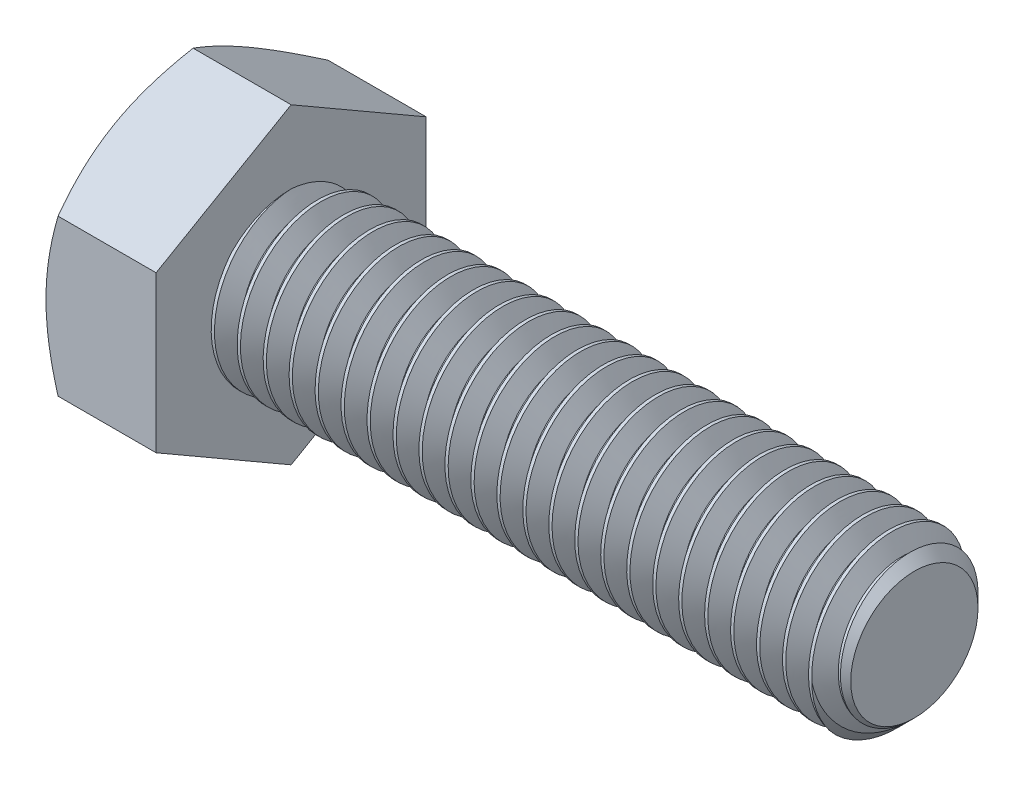
from build123d import *

# Parameters (mm, degrees)
SKETCH2_R           = 4
BOSS_EXTRUDE1_DEPTH = 30
CHAMFER1_SIZE       = 0.9375
CUT_SWEEP1_PITCH    = 1.25
BOSS_EXTRUDE2_DEPTH = 5.3
SKETCH6_OUTSIDE_W   = 153.592
SKETCH6_OUTSIDE_H   = 155.604
SKETCH6_OUTSIDE_R   = 6.5
CUT_EXTRUDE1_DEPTH  = 37.66978788
CUT_EXTRUDE1_DRAFT  = -60
SKETCH7_W           = 0.263417301
SKETCH7_H           = 0.263417301
CUT_EXTRUDE2_DEPTH  = 0.25


with BuildPart() as part:
    # Sketch2 → Boss-Extrude1 (new body)
    with BuildSketch(Plane(origin=(17.65, 0, 0), x_dir=(0, 0, -1), z_dir=(1, 0, 0))):
        Circle(SKETCH2_R)
    extrude(amount=-BOSS_EXTRUDE1_DEPTH)

    # Chamfer1
    chamfer1_edges = [part.edges().sort_by_distance(p)[0] for p in [
        (17.65, 0, 4),
    ]]
    chamfer(chamfer1_edges, length=CHAMFER1_SIZE)

    # Cut-Sweep1: arcs per turn and ends read off the stored shape
    # Cut-Sweep1: the profile of Sketch5 profile screwed along a right-hand helix through 25 turns, 8 arcs to a turn; built about Z, then put on its axis
    cut_sweep1_z = Axis((0, 0, 0), (0, 0, 1))
    cut_sweep1_corners = [(4.0003, 0, 0.000173205), (3.188101184, 0, -0.46875), (3.188101184, 0, -0.625), (4.0003, 0, -1.093923205)]
    with BuildLine(mode=Mode.PRIVATE) as cut_sweep1_profile:
        Line(cut_sweep1_corners[0], cut_sweep1_corners[1])
        Line(cut_sweep1_corners[1], cut_sweep1_corners[2])
        Line(cut_sweep1_corners[2], cut_sweep1_corners[3])
        Line(cut_sweep1_corners[3], cut_sweep1_corners[0])
    cut_sweep1_cap = Face(cut_sweep1_profile.wire())
    cut_sweep1_turn_angles = [0, 22.5, 45, 67.5, 90, 112.5, 135, 157.5, 180, 202.5, 225, 247.5, 270, 292.5, 315, 337.5, 360]
    cut_sweep1_turn_weights = [1, 0.9238795325112867, 1, 0.9238795325112867, 1, 0.9238795325112867, 1, 0.9238795325112867, 1, 0.9238795325112867, 1, 0.9238795325112867, 1, 0.9238795325112867, 1, 0.9238795325112867, 1]
    cut_sweep1_turn_rails = [Edge.make_bspline([Vector(p[0], p[1], 0).rotate(cut_sweep1_z, cut_sweep1_turn_angles[k]) / cut_sweep1_turn_weights[k] + Vector(0, 0, p[2] + CUT_SWEEP1_PITCH * cut_sweep1_turn_angles[k] / 360) for k in range(17)], [0, 0, 0, 1, 1, 2, 2, 3, 3, 4, 4, 5, 5, 6, 6, 7, 7, 8, 8, 8], 2, cut_sweep1_turn_weights) for p in cut_sweep1_corners]
    cut_sweep1_turn_sides = [Face.make_surface_from_curves(cut_sweep1_turn_rails[p[0]], cut_sweep1_turn_rails[p[1]]) for p in [(0, 1), (1, 2), (2, 3), (3, 0)]]
    cut_sweep1 = Plane(origin=(17.65, 0, 0), x_dir=(0, 1, 0), z_dir=(-1, 0, 0)) * Solid(Shell([*[p.moved(Location((0, 0, CUT_SWEEP1_PITCH * i))) for i in range(25) for p in cut_sweep1_turn_sides], cut_sweep1_cap, cut_sweep1_cap.rotate(cut_sweep1_z, 9000).moved(Location((0, 0, CUT_SWEEP1_PITCH * 9000 / 360)))]))
    add(cut_sweep1, mode=Mode.SUBTRACT)

    # Sketch3 → Boss-Extrude2 (add)
    with BuildSketch(Plane.ZY.offset(12.35)):
        Polygon((-6.5, -3.75277675), (0, -7.505553499), (6.5, -3.75277675), (6.5, 3.75277675), (0, 7.505553499), (-6.5, 3.75277675), align=None)
    extrude(amount=BOSS_EXTRUDE2_DEPTH)


with BuildPart() as cut_extrude1_tool:
    # Sketch6 outside → Cut-Extrude1 (with draft: the straight prism first)
    with BuildSketch(Plane.ZY.offset(17.65)):
        Rectangle(SKETCH6_OUTSIDE_W, SKETCH6_OUTSIDE_H)
        Circle(SKETCH6_OUTSIDE_R, mode=Mode.SUBTRACT)
    extrude(amount=-CUT_EXTRUDE1_DEPTH)
    # Cut-Extrude1: the draft: its side faces are tilted about the plane it starts from
    cut_extrude1_sides = [cut_extrude1_tool.faces().sort_by_distance(p)[0] for p in [
        (1.18489394, -77.802, 0),
        (1.18489394, 0, 76.796),
        (1.18489394, 77.802, 0),
        (1.18489394, 0, -76.796),
        (1.18489394, 0, -6.5),
    ]]
    draft(cut_extrude1_sides, Plane.ZY.offset(17.65), CUT_EXTRUDE1_DRAFT)


with BuildPart() as part_1:
    add(part.part)

    # Cut-Extrude1: cut by cut_extrude1_tool
    add(cut_extrude1_tool.part, mode=Mode.SUBTRACT)

    # Sketch7 → Cut-Extrude2 (cut)
    # profile 1 of 4: a face of its own
    with BuildSketch(Plane.ZY.offset(17.65)):
        with BuildLine():
            Line((-1.712212457, 3.25), (-1.975629758, 3.25))
            Line((-1.975629758, 3.25), (-1.975629758, 4.851083283))
            add(Edge.make_bspline(
                [(-1.975629758, 4.851083283), (-1.990797349, 4.836456007), (-2.022321526, 4.806054817), (-2.075609816, 4.763029542), (-2.135086359, 4.719421601), (-2.199978812, 4.677487692), (-2.266125691, 4.638011438), (-2.330048133, 4.602508617), (-2.390678926, 4.572464616), (-2.430616757, 4.556036438), (-2.449780899, 4.548153387)],
                knots=[0, 0, 0, 0, 0.893362401, 1.856755847, 2.901947673, 4.020460078, 5.132200827, 6.168787962, 7.121294059, 8, 8, 8, 8], degree=3))
            Line((-2.449780899, 4.548153387), (-2.449780899, 4.790991211))
            add(Edge.make_bspline(
                [(-2.449780899, 4.790991211), (-2.416864504, 4.807943221), (-2.351988236, 4.841354628), (-2.260332099, 4.899060722), (-2.174761236, 4.961616503), (-2.096692183, 5.029008122), (-2.026708251, 5.097894454), (-1.967731776, 5.167403469), (-1.918384014, 5.234987266), (-1.893625307, 5.28211947), (-1.881787344, 5.304654948)],
                knots=[0, 0, 0, 0, 1.141258006, 2.249351951, 3.335817539, 4.406819942, 5.426913362, 6.360259544, 7.215985427, 8, 8, 8, 8], degree=3))
            Line((-1.881787344, 5.304654948), (-1.712212457, 5.304654948))
            Line((-1.712212457, 5.304654948), (-1.712212457, 3.25))
        make_face()
    # profile 2 of 4: a face of its own
    with BuildSketch(Plane.ZY.offset(17.65)):
        with BuildLine():
            add(Edge.make_bspline(
                [(-1.053669204, 4.26333343), (-1.053403811, 4.292696335), (-1.052884018, 4.350205901), (-1.04965991, 4.434352728), (-1.044030879, 4.514263485), (-1.035628286, 4.589868774), (-1.025678041, 4.66133925), (-1.01274266, 4.728572918), (-0.998188475, 4.791720628), (-0.980726066, 4.850716558), (-0.961540595, 4.906067965), (-0.939774065, 4.957686055), (-0.915283767, 5.005516098), (-0.889273246, 5.05005412), (-0.860373255, 5.090607372), (-0.830328139, 5.128313943), (-0.796954399, 5.161790986), (-0.761639786, 5.191899869), (-0.723864284, 5.218469203), (-0.683827763, 5.241395334), (-0.641684272, 5.261637455), (-0.596630603, 5.276875718), (-0.549602061, 5.289298133), (-0.500236646, 5.298436212), (-0.448479956, 5.303823417), (-0.413111534, 5.30437464), (-0.395125952, 5.304654948)],
                knots=[0, 0, 0, 0, 1.514747001, 2.966751498, 4.343369068, 5.64627492, 6.890416844, 8.064737671, 9.177176366, 10.232018008, 11.237056675, 12.19799043, 13.119080079, 14.007588942, 14.855863561, 15.685992447, 16.491747269, 17.290132607, 18.077525251, 18.870243746, 19.668095604, 20.485086593, 21.319398728, 22.175900658, 23.072407314, 24, 24, 24, 24], degree=3))
            add(Edge.make_bspline(
                [(-0.395125952, 5.304654948), (-0.368738762, 5.303879183), (-0.316900071, 5.302355162), (-0.241215314, 5.289925525), (-0.169887308, 5.268662714), (-0.102962395, 5.239978266), (-0.041584646, 5.203543495), (0.01322827, 5.159251481), (0.060885109, 5.107567279), (0.100865769, 5.04787845), (0.135812857, 4.981831611), (0.166859083, 4.909130317), (0.194923969, 4.82985604), (0.214839423, 4.758894496), (0.2290451, 4.697637972), (0.23844813, 4.647115325), (0.246254529, 4.592601104), (0.252235287, 4.534227193), (0.257142357, 4.472059066), (0.260931862, 4.406058014), (0.262855424, 4.336059078), (0.263226498, 4.28802977), (0.263417301, 4.26333343)],
                knots=[0, 0, 0, 0, 1.134486744, 2.228744715, 3.287356444, 4.328707449, 5.352829806, 6.347195599, 7.349461267, 8.364207941, 9.428085653, 10.559314403, 11.761222316, 13.04268526, 13.726896727, 14.465273606, 15.252205015, 16.094778733, 16.988606776, 17.934225168, 18.937792761, 20, 20, 20, 20], degree=3))
            add(Edge.make_bspline(
                [(0.263417301, 4.26333343), (0.263146937, 4.234108446), (0.262618727, 4.177011689), (0.259481011, 4.093539578), (0.253512791, 4.014231709), (0.246168788, 3.93890641), (0.23505885, 3.867764764), (0.223087289, 3.80050451), (0.208281426, 3.737431068), (0.191006459, 3.678516795), (0.171550924, 3.623450173), (0.15021492, 3.57181504), (0.126583246, 3.523646677), (0.099952535, 3.479414897), (0.071541263, 3.438532594), (0.041141347, 3.400846412), (0.008108274, 3.366898762), (-0.027524579, 3.336880189), (-0.065034849, 3.309839686), (-0.105168706, 3.286687205), (-0.147750491, 3.267505776), (-0.192495698, 3.251106608), (-0.239858332, 3.239090259), (-0.289464895, 3.229891932), (-0.341498164, 3.224475291), (-0.377003388, 3.223934368), (-0.395125952, 3.22365827)],
                knots=[0, 0, 0, 0, 1.508974709, 2.94807912, 4.311757619, 5.615040294, 6.854280449, 8.028314546, 9.141715822, 10.197470207, 11.196696834, 12.155719058, 13.080757287, 13.963948316, 14.818758719, 15.649605906, 16.461113142, 17.260189315, 18.052359509, 18.845763934, 19.647754795, 20.461145776, 21.303032214, 22.167241874, 23.064524267, 24, 24, 24, 24], degree=3))
            add(Edge.make_bspline(
                [(-0.395125952, 3.22365827), (-0.418886733, 3.224336047), (-0.465213718, 3.225657527), (-0.532870864, 3.234636168), (-0.596370704, 3.250438997), (-0.656248823, 3.271632819), (-0.711832175, 3.299980776), (-0.763386148, 3.334471601), (-0.811946681, 3.37430283), (-0.839901077, 3.405728755), (-0.854048281, 3.421632835)],
                knots=[0, 0, 0, 0, 1.10322584, 2.150986741, 3.161425019, 4.136713905, 5.093944212, 6.049774532, 7.013026876, 8, 8, 8, 8], degree=3))
            add(Edge.make_bspline(
                [(-0.854048281, 3.421632835), (-0.870332038, 3.445122393), (-0.903909841, 3.493558868), (-0.943209749, 3.57614755), (-0.978265963, 3.667066094), (-1.005778664, 3.76809831), (-1.027327966, 3.878440095), (-1.042891943, 3.998307965), (-1.051699622, 4.127650132), (-1.052997856, 4.217084674), (-1.053669204, 4.26333343)],
                knots=[0, 0, 0, 0, 0.779365345, 1.607084704, 2.489375761, 3.438383567, 4.461919411, 5.557722155, 6.737039282, 8, 8, 8, 8], degree=3))
        make_face()
        with BuildLine():
            add(Edge.make_bspline(
                [(-0.790251903, 4.264156609), (-0.789990351, 4.224638121), (-0.789489681, 4.148990994), (-0.784258903, 4.040916022), (-0.775254335, 3.943417645), (-0.763349706, 3.856630855), (-0.747630777, 3.780438257), (-0.727893802, 3.715034013), (-0.705645537, 3.659633124), (-0.678113731, 3.61492224), (-0.647969444, 3.578476348), (-0.616847528, 3.547131701), (-0.584015791, 3.52048947), (-0.549688457, 3.498275282), (-0.513332913, 3.481456158), (-0.4753467, 3.46926562), (-0.435721553, 3.462250153), (-0.408735027, 3.461242162), (-0.395125952, 3.460733841)],
                knots=[0, 0, 0, 0, 1.89448813, 3.626469325, 5.185477471, 6.587276848, 7.82441448, 8.910550357, 9.859733512, 10.6775885, 11.416198291, 12.123144072, 12.791880183, 13.439617036, 14.078171869, 14.70637855, 15.347637704, 16, 16, 16, 16], degree=3))
            add(Edge.make_bspline(
                [(-0.395125952, 3.460733841), (-0.381520284, 3.461253269), (-0.354540516, 3.462283284), (-0.314823811, 3.469144054), (-0.276985394, 3.481962153), (-0.240684056, 3.498721871), (-0.206107221, 3.520429731), (-0.17343673, 3.547172596), (-0.14215087, 3.578498631), (-0.11214199, 3.615368141), (-0.084819938, 3.660285738), (-0.062154323, 3.715641498), (-0.042724938, 3.781160284), (-0.026919756, 3.857314062), (-0.014966019, 3.943963635), (-0.006015893, 4.041191596), (-0.000750109, 4.149127511), (-0.000257703, 4.224637943), (0, 4.264156609)],
                knots=[0, 0, 0, 0, 0.652509534, 1.29391342, 1.924290653, 2.562989607, 3.207355802, 3.876242846, 4.583348185, 5.32723334, 6.150888545, 7.094226006, 8.186903555, 9.424320409, 10.81992305, 12.379283064, 14.105084285, 16, 16, 16, 16], degree=3))
            add(Edge.make_bspline(
                [(0, 4.264156609), (-0.000249452, 4.30285302), (-0.000727391, 4.376993878), (-0.006128987, 4.482986783), (-0.014593772, 4.57884869), (-0.026172254, 4.664667974), (-0.041560054, 4.740351467), (-0.060223356, 4.806060288), (-0.082463471, 4.861654304), (-0.108906889, 4.907691956), (-0.138343703, 4.94545532), (-0.169093247, 4.978142798), (-0.201924261, 5.005942433), (-0.237418413, 5.02824371), (-0.274431658, 5.046235551), (-0.313814468, 5.058617994), (-0.35517974, 5.06622538), (-0.38356819, 5.067122888), (-0.398007078, 5.067579377)],
                knots=[0, 0, 0, 0, 1.850066095, 3.544656626, 5.0727657, 6.45041401, 7.682899467, 8.762389858, 9.712573485, 10.538438529, 11.291566246, 11.996865408, 12.681389046, 13.341983376, 13.996294293, 14.643563182, 15.31009126, 16, 16, 16, 16], degree=3))
            add(Edge.make_bspline(
                [(-0.398007078, 5.067579377), (-0.411615299, 5.067222215), (-0.438448966, 5.066517937), (-0.47773697, 5.059795612), (-0.514969749, 5.048554386), (-0.550573872, 5.033327055), (-0.583660499, 5.012834074), (-0.615541766, 4.98890706), (-0.644724475, 4.959754665), (-0.66230972, 4.93796079), (-0.671302528, 4.926815757)],
                knots=[0, 0, 0, 0, 1.021318143, 2.013908504, 2.982026795, 3.937174072, 4.91255697, 5.897578595, 6.924855925, 8, 8, 8, 8], degree=3))
            add(Edge.make_bspline(
                [(-0.671302528, 4.926815757), (-0.681092952, 4.910447155), (-0.701768267, 4.875880115), (-0.724902742, 4.815801176), (-0.745338823, 4.747142384), (-0.762164493, 4.668847374), (-0.774336685, 4.581050453), (-0.78394616, 4.483853581), (-0.788937924, 4.37712106), (-0.789801826, 4.302850334), (-0.790251903, 4.264156609)],
                knots=[0, 0, 0, 0, 0.671104906, 1.417232262, 2.260109084, 3.195198885, 4.23592645, 5.382417421, 6.636286093, 8, 8, 8, 8], degree=3))
        make_face(mode=Mode.SUBTRACT)
    # profile 3 of 4: a face of its own
    with BuildSketch(Plane.ZY.offset(17.65)):
        with Locations((0.790251904, 3.381708651)):
            Rectangle(SKETCH7_W, SKETCH7_H)
    # profile 4 of 4: a face of its own
    with BuildSketch(Plane.ZY.offset(17.65)):
        with BuildLine():
            Line((1.343428235, 3.750492872), (1.606845536, 3.776834602))
            add(Edge.make_bspline(
                [(1.606845536, 3.776834602), (1.609226986, 3.763338136), (1.61383053, 3.737248323), (1.624219278, 3.700065869), (1.634756016, 3.665396831), (1.648357527, 3.634013553), (1.662522508, 3.605063578), (1.678563961, 3.578837007), (1.69676769, 3.555860592), (1.722473745, 3.52893633), (1.758946895, 3.500840405), (1.809503625, 3.478081611), (1.865120776, 3.462779267), (1.904315553, 3.461431235), (1.924592656, 3.460733841)],
                knots=[0, 0, 0, 0, 0.994516507, 1.922484754, 2.80151264, 3.623050913, 4.402748861, 5.140924173, 5.850441436, 6.526872911, 7.841975818, 9.161260782, 10.53140107, 12, 12, 12, 12], degree=3))
            add(Edge.make_bspline(
                [(1.924592656, 3.460733841), (1.942335318, 3.46137277), (1.977255627, 3.462630282), (2.028170595, 3.472378616), (2.076589938, 3.487995243), (2.121670811, 3.510401832), (2.163249141, 3.537670026), (2.199566411, 3.570070133), (2.231107568, 3.606206721), (2.257012656, 3.647843004), (2.279123348, 3.695398627), (2.300015011, 3.7494784), (2.319778178, 3.811014023), (2.337342519, 3.879220631), (2.353070526, 3.951608123), (2.36410829, 4.026536277), (2.370899396, 4.102548373), (2.37162589, 4.153699284), (2.371990478, 4.179369165)],
                knots=[0, 0, 0, 0, 0.897794352, 1.766998465, 2.614902619, 3.466100941, 4.308008728, 5.124841802, 5.922729683, 6.728261092, 7.598214292, 8.574707161, 9.662086263, 10.868425066, 12.139522319, 13.41071447, 14.70057738, 16, 16, 16, 16], degree=3))
            add(Edge.make_bspline(
                [(2.371990478, 4.179369165), (2.371865792, 4.186366486), (2.371567489, 4.203107167), (2.371054359, 4.219842715), (2.370755709, 4.229583088)],
                knots=[0, 0, 0, 0, 0.835966126, 2, 2, 2, 2], degree=3))
            add(Edge.make_bspline(
                [(2.370755709, 4.229583088), (2.358056779, 4.21029884), (2.332679381, 4.171761418), (2.285927945, 4.120039532), (2.232443482, 4.074161517), (2.173037847, 4.03448362), (2.109177907, 4.001920759), (2.041974623, 3.978259264), (1.972007314, 3.963648603), (1.924388684, 3.962040101), (1.900308873, 3.961226713)],
                knots=[0, 0, 0, 0, 0.978840568, 1.956103883, 2.947027447, 3.962820877, 4.980997961, 5.980964245, 6.979013046, 8, 8, 8, 8], degree=3))
            add(Edge.make_bspline(
                [(1.900308873, 3.961226713), (1.880242283, 3.961746616), (1.840740816, 3.962770056), (1.782878116, 3.971866063), (1.72722554, 3.985506849), (1.674310458, 4.00615966), (1.623309587, 4.031701873), (1.574758435, 4.063052981), (1.528582191, 4.100170311), (1.485377524, 4.142591689), (1.445949465, 4.189875867), (1.411178467, 4.240870912), (1.382304678, 4.295826174), (1.358280685, 4.35405573), (1.339743646, 4.416122198), (1.32686283, 4.48188015), (1.318199864, 4.551078568), (1.317462547, 4.598477128), (1.317086505, 4.622651092)],
                knots=[0, 0, 0, 0, 0.975490236, 1.920271282, 2.842894855, 3.757591483, 4.67685385, 5.613562631, 6.563069669, 7.554119451, 8.55387214, 9.553424333, 10.550567425, 11.568071726, 12.613215376, 13.695622473, 14.824733476, 16, 16, 16, 16], degree=3))
            add(Edge.make_bspline(
                [(1.317086505, 4.622651092), (1.317649718, 4.647643937), (1.318751461, 4.696534277), (1.327073801, 4.768018026), (1.340842359, 4.835739983), (1.360921901, 4.899570884), (1.385753581, 4.95992086), (1.417065367, 5.016354799), (1.453651568, 5.069114111), (1.495730787, 5.117690149), (1.541975466, 5.161276301), (1.591073928, 5.200177701), (1.643665963, 5.232154466), (1.698743165, 5.25881511), (1.756722343, 5.279418859), (1.817504403, 5.294311039), (1.88125754, 5.303049305), (1.924702865, 5.304113318), (1.94681849, 5.304654948)],
                knots=[0, 0, 0, 0, 1.151671969, 2.252870106, 3.311924673, 4.331900944, 5.332425074, 6.314476151, 7.300265758, 8.286521684, 9.270545387, 10.225535917, 11.167946231, 12.101233205, 13.04124339, 13.998220545, 14.981004193, 16, 16, 16, 16], degree=3))
            add(Edge.make_bspline(
                [(1.94681849, 5.304654948), (1.962880806, 5.304330093), (1.99480732, 5.30368439), (2.0423206, 5.298754658), (2.088708773, 5.289868011), (2.134274283, 5.278650564), (2.178248567, 5.263079902), (2.221479299, 5.245074026), (2.263445052, 5.223051477), (2.304390355, 5.198009079), (2.344058042, 5.170387031), (2.3805546, 5.138652287), (2.415338776, 5.104974281), (2.447702759, 5.068296042), (2.476622878, 5.028051504), (2.504062511, 4.985663509), (2.52869893, 4.940207137), (2.551165634, 4.891620825), (2.571161871, 4.838904439), (2.587843743, 4.780893002), (2.602143829, 4.717385587), (2.614050061, 4.648298015), (2.622878726, 4.573679539), (2.629376108, 4.493641057), (2.633629665, 4.408121689), (2.633988336, 4.349223752), (2.63417301, 4.318898017)],
                knots=[0, 0, 0, 0, 0.850689348, 1.69088598, 2.526071361, 3.350886897, 4.173587108, 4.994166539, 5.82944675, 6.680632524, 7.535501428, 8.385942454, 9.238956306, 10.098905971, 10.972410977, 11.861345628, 12.77184846, 13.708225841, 14.694799433, 15.754852217, 16.902446579, 18.141290626, 19.466225842, 20.880733292, 22.39393263, 24, 24, 24, 24], degree=3))
            add(Edge.make_bspline(
                [(2.63417301, 4.318898017), (2.6339871, 4.287200532), (2.633624768, 4.225423409), (2.629337817, 4.135244488), (2.622843702, 4.049998487), (2.614008798, 3.969629425), (2.602019565, 3.894259963), (2.587769409, 3.823903275), (2.570963778, 3.758429473), (2.551214715, 3.697832808), (2.528763845, 3.641416901), (2.504164324, 3.588487072), (2.476614223, 3.539121596), (2.446423095, 3.493225799), (2.413978613, 3.450719463), (2.37877421, 3.411716455), (2.340798452, 3.376334676), (2.300535409, 3.344175938), (2.258045506, 3.315836014), (2.213907178, 3.290829556), (2.167622297, 3.27034489), (2.119666686, 3.253540006), (2.070125559, 3.239664847), (2.018595398, 3.23031574), (1.965314272, 3.225020725), (1.929268891, 3.224116369), (1.911010201, 3.22365827)],
                knots=[0, 0, 0, 0, 1.538356107, 2.998194159, 4.380716326, 5.687456969, 6.921258146, 8.08355215, 9.170518603, 10.200253214, 11.174652363, 12.115998813, 13.031191965, 13.915860606, 14.780247615, 15.624154577, 16.462764255, 17.29681422, 18.1223677, 18.939254916, 19.756006416, 20.575278551, 21.404021733, 22.250368457, 23.113728878, 24, 24, 24, 24], degree=3))
            add(Edge.make_bspline(
                [(1.911010201, 3.22365827), (1.891643664, 3.223993119), (1.853752955, 3.224648253), (1.798436419, 3.231537028), (1.745740074, 3.242010212), (1.695817287, 3.257471112), (1.648294181, 3.276503064), (1.603981885, 3.300824816), (1.562092911, 3.328884843), (1.523144042, 3.361248996), (1.487591314, 3.397798428), (1.45542289, 3.437632363), (1.42722066, 3.481266718), (1.403132215, 3.528444239), (1.381795442, 3.57876802), (1.365253639, 3.632912869), (1.351815016, 3.690379413), (1.346268973, 3.730131475), (1.343428235, 3.750492872)],
                knots=[0, 0, 0, 0, 1.08199657, 2.11693069, 3.111083497, 4.081436044, 5.034173265, 5.967546613, 6.901297947, 7.84883568, 8.792454994, 9.747011506, 10.706361727, 11.690764787, 12.70483191, 13.757514363, 14.851376857, 16, 16, 16, 16], degree=3))
        make_face()
        with BuildLine():
            add(Edge.make_bspline(
                [(2.370755709, 4.628413345), (2.370459446, 4.644889997), (2.369882788, 4.676960744), (2.364830564, 4.723751563), (2.356701567, 4.767814617), (2.345291922, 4.809403273), (2.329797284, 4.848076676), (2.311847803, 4.884737747), (2.289897393, 4.918370349), (2.26513021, 4.949427371), (2.237848658, 4.97720716), (2.208139299, 5.001428652), (2.176559161, 5.022191962), (2.142350633, 5.038517507), (2.106638259, 5.051969698), (2.068564179, 5.060761527), (2.028652287, 5.066920378), (2.00117341, 5.06735675), (1.987154265, 5.067579377)],
                knots=[0, 0, 0, 0, 1.20361398, 2.342757417, 3.433960756, 4.474970456, 5.487648377, 6.473933575, 7.452701285, 8.415527761, 9.372491588, 10.291530068, 11.211879743, 12.12647906, 13.055739058, 13.994253148, 14.97671008, 16, 16, 16, 16], degree=3))
            add(Edge.make_bspline(
                [(1.987154265, 5.067579377), (1.972734284, 5.067142412), (1.944326885, 5.066281591), (1.902690191, 5.060737863), (1.863202918, 5.050123331), (1.82559848, 5.036043394), (1.789459226, 5.018626761), (1.756098961, 4.995805648), (1.724120441, 4.969943671), (1.694806273, 4.939940334), (1.668028748, 4.907044916), (1.644434797, 4.871566178), (1.624565701, 4.833486737), (1.608682838, 4.792965357), (1.595702867, 4.750355226), (1.58678655, 4.705275342), (1.581300213, 4.657773697), (1.580773232, 4.625273277), (1.580503806, 4.608657048)],
                knots=[0, 0, 0, 0, 1.007165334, 1.984118292, 2.925321257, 3.856078893, 4.785899085, 5.718627206, 6.671847665, 7.654235469, 8.641842333, 9.630378272, 10.624608936, 11.635186472, 12.665777387, 13.731187195, 14.840042241, 16, 16, 16, 16], degree=3))
            add(Edge.make_bspline(
                [(1.580503806, 4.608657048), (1.580752641, 4.593818186), (1.58124051, 4.564724947), (1.587050486, 4.522266014), (1.594800132, 4.481742842), (1.607154533, 4.443569068), (1.622037996, 4.407190484), (1.641381922, 4.373442578), (1.66316134, 4.341316222), (1.688680145, 4.311887654), (1.716891239, 4.285190782), (1.74770348, 4.261921586), (1.780727677, 4.242002749), (1.81627064, 4.225970909), (1.854119219, 4.213624034), (1.894188934, 4.204534243), (1.936653958, 4.199120139), (1.965735789, 4.198578529), (1.980568832, 4.198302284)],
                knots=[0, 0, 0, 0, 1.102204012, 2.160993585, 3.181057555, 4.164839289, 5.138418409, 6.097303793, 7.050641095, 8.019669129, 8.986440483, 9.932879371, 10.884360123, 11.847412593, 12.824617322, 13.839006415, 14.897795988, 16, 16, 16, 16], degree=3))
            add(Edge.make_bspline(
                [(1.980568832, 4.198302284), (1.994442526, 4.198581229), (2.021749061, 4.199130255), (2.061750264, 4.204567439), (2.099758927, 4.213674087), (2.135945704, 4.226054959), (2.170251941, 4.242081256), (2.202446951, 4.262158383), (2.233153085, 4.285161675), (2.261470231, 4.312039898), (2.287351065, 4.341799347), (2.309733175, 4.37473402), (2.328846295, 4.410245813), (2.343890266, 4.448755659), (2.355939774, 4.489789433), (2.364423428, 4.533606928), (2.369979224, 4.580114604), (2.370492966, 4.612070273), (2.370755709, 4.628413345)],
                knots=[0, 0, 0, 0, 1.017004716, 2.00169281, 2.953445817, 3.879374072, 4.80207141, 5.723561102, 6.657273834, 7.611045633, 8.581233951, 9.544037932, 10.525327521, 11.53237926, 12.57032081, 13.657564536, 14.802009319, 16, 16, 16, 16], degree=3))
        make_face(mode=Mode.SUBTRACT)
    extrude(amount=-CUT_EXTRUDE2_DEPTH, mode=Mode.SUBTRACT)


solid = part_1.part
